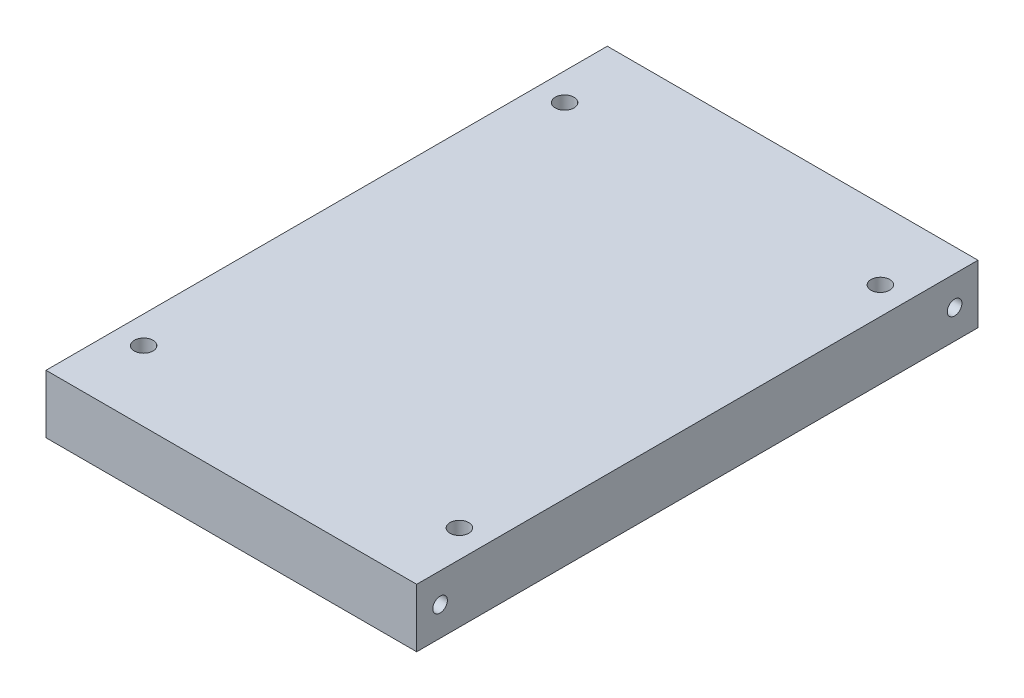
from build123d import *

# Parameters (mm, degrees)
SKETCH1_W           = 63.4
SKETCH1_H           = 96
SKETCH1_R           = 1.6
BOSS_EXTRUDE1_DEPTH = 10
SKETCH2_R           = 1.25
CUT_EXTRUDE1_DEPTH  = 10


with BuildPart() as part:
    # Sketch1 → Boss-Extrude1 (new body)
    with BuildSketch(Plane.XZ.offset(-316.566699204)):
        with Locations((0, 23.58434623)):
            Rectangle(SKETCH1_W, SKETCH1_H)
        with Locations((-27, 59.58434623)):
            Circle(SKETCH1_R, mode=Mode.SUBTRACT)
        with Locations((27, 59.58434623)):
            Circle(SKETCH1_R, mode=Mode.SUBTRACT)
        with Locations((-27, -12.41565377)):
            Circle(SKETCH1_R, mode=Mode.SUBTRACT)
        with Locations((27, -12.41565377)):
            Circle(SKETCH1_R, mode=Mode.SUBTRACT)
    extrude(amount=BOSS_EXTRUDE1_DEPTH)

    # Sketch2 → Cut-Extrude1 (cut)
    with BuildSketch(Plane.ZY.offset(31.7)):
        with Locations((-20.41565377, 311.566699204)):
            Circle(SKETCH2_R)
        with Locations((67.58434623, 311.566699204)):
            Circle(SKETCH2_R)
    cut_extrude1 = extrude(amount=-CUT_EXTRUDE1_DEPTH, mode=Mode.SUBTRACT)

    # Mirror1: Cut-Extrude1 across plane
    add(cut_extrude1.mirror(Plane(origin=(0, 0, 0), x_dir=(0, 0, 1), z_dir=(1, 0, 0))), mode=Mode.SUBTRACT)


solid = part.part
